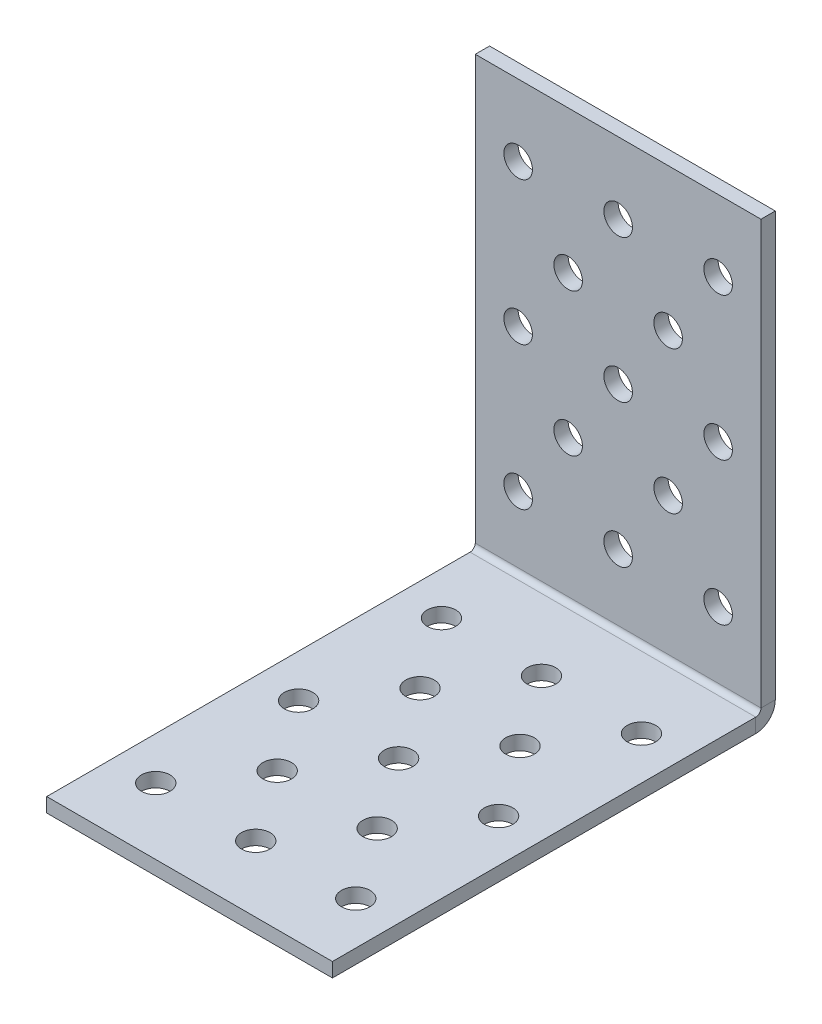
from build123d import *

# Parameters (mm, degrees)
SKETCH1_W                    = 40
SKETCH1_H                    = 60
SKETCH1_R                    = 2
BASE_FLANGE1_DEPTH           = 2
EDGE_FLANGE1_STRIP_W         = 9.4732
EDGE_FLANGE1_STRIP_H         = 2
EDGE_FLANGE1_STRIP_CUT_DEPTH = 40
EDGE_FLANGE1_DEPTH           = 40
SKETCH7_R                    = 2
CUT_EXTRUDE1_DEPTH           = 10


# Sheet-metal steps are written as plain solids
with BuildPart() as part:
    # Sketch1 → Base-Flange1 (new body)
    with BuildSketch(Plane.XY):
        with Locations((0, 30)):
            Rectangle(SKETCH1_W, SKETCH1_H)
        with Locations((-14, 50)):
            Circle(SKETCH1_R, mode=Mode.SUBTRACT)
        with Locations((0, 50)):
            Circle(SKETCH1_R, mode=Mode.SUBTRACT)
        with Locations((14, 50)):
            Circle(SKETCH1_R, mode=Mode.SUBTRACT)
        with Locations((-7, 40)):
            Circle(SKETCH1_R, mode=Mode.SUBTRACT)
        with Locations((7, 40)):
            Circle(SKETCH1_R, mode=Mode.SUBTRACT)
        with Locations((-14, 30)):
            Circle(SKETCH1_R, mode=Mode.SUBTRACT)
        with Locations((-7, 20)):
            Circle(SKETCH1_R, mode=Mode.SUBTRACT)
        with Locations((7, 20)):
            Circle(SKETCH1_R, mode=Mode.SUBTRACT)
        with Locations((0, 30)):
            Circle(SKETCH1_R, mode=Mode.SUBTRACT)
        with Locations((14, 30)):
            Circle(SKETCH1_R, mode=Mode.SUBTRACT)
        with Locations((-14, 10)):
            Circle(SKETCH1_R, mode=Mode.SUBTRACT)
        with Locations((0, 10)):
            Circle(SKETCH1_R, mode=Mode.SUBTRACT)
        with Locations((14, 10)):
            Circle(SKETCH1_R, mode=Mode.SUBTRACT)
    extrude(amount=-BASE_FLANGE1_DEPTH)

    # Edge-Flange1 strip (across the edge) → Edge-Flange1 strip cut (cut)
    with BuildSketch(Plane.YZ.offset(-20)):
        with Locations((-4, -1)):
            Rectangle(EDGE_FLANGE1_STRIP_W, EDGE_FLANGE1_STRIP_H)
    extrude(amount=EDGE_FLANGE1_STRIP_CUT_DEPTH, mode=Mode.SUBTRACT)

    # Edge-Flange1 section (across the edge) → Edge-Flange1 (add)
    with BuildSketch(Plane.YZ.offset(-20)):
        with BuildLine():
            Line((-2, 0.7366), (-2, 60))
            Line((-2, 60), (0, 60))
            Line((0, 60), (0, 0.7366))
            ThreePointArc((0, 0.7366), (0.215745145, 0.215745145), (0.7366, 0))
            Line((0.7366, 0), (0.7366, -2))
            ThreePointArc((0.7366, -2), (-1.198468417, -1.198468417), (-2, 0.7366))
        make_face()
    extrude(amount=EDGE_FLANGE1_DEPTH)

    # Sketch7 → Cut-Extrude1 (cut)
    with BuildSketch(Plane(origin=(0, 0, 0), x_dir=(1, 0, 0), z_dir=(0, 1, 0))):
        with Locations(Location((-14, -10.7366, 0), (0, 0, 270))):
            Circle(SKETCH7_R)
        with Locations(Location((0, -10.7366, 0), (0, 0, 270))):
            Circle(SKETCH7_R)
        with Locations(Location((14, -10.7366, 0), (0, 0, 270))):
            Circle(SKETCH7_R)
        with Locations(Location((-7, -20.7366, 0), (0, 0, 270))):
            Circle(SKETCH7_R)
        with Locations(Location((7, -20.7366, 0), (0, 0, 270))):
            Circle(SKETCH7_R)
        with Locations(Location((-14, -30.7366, 0), (0, 0, 270))):
            Circle(SKETCH7_R)
        with Locations(Location((0, -30.7366, 0), (0, 0, 270))):
            Circle(SKETCH7_R)
        with Locations(Location((14, -30.7366, 0), (0, 0, 270))):
            Circle(SKETCH7_R)
        with Locations(Location((-7, -40.7366, 0), (0, 0, 270))):
            Circle(SKETCH7_R)
        with Locations(Location((7, -40.7366, 0), (0, 0, 270))):
            Circle(SKETCH7_R)
        with Locations(Location((14, -50.7366, 0), (0, 0, 270))):
            Circle(SKETCH7_R)
        with Locations(Location((0, -50.7366, 0), (0, 0, 270))):
            Circle(SKETCH7_R)
        with Locations(Location((-14, -50.7366, 0), (0, 0, 270))):
            Circle(SKETCH7_R)
    extrude(amount=-CUT_EXTRUDE1_DEPTH, mode=Mode.SUBTRACT)


solid = part.part
